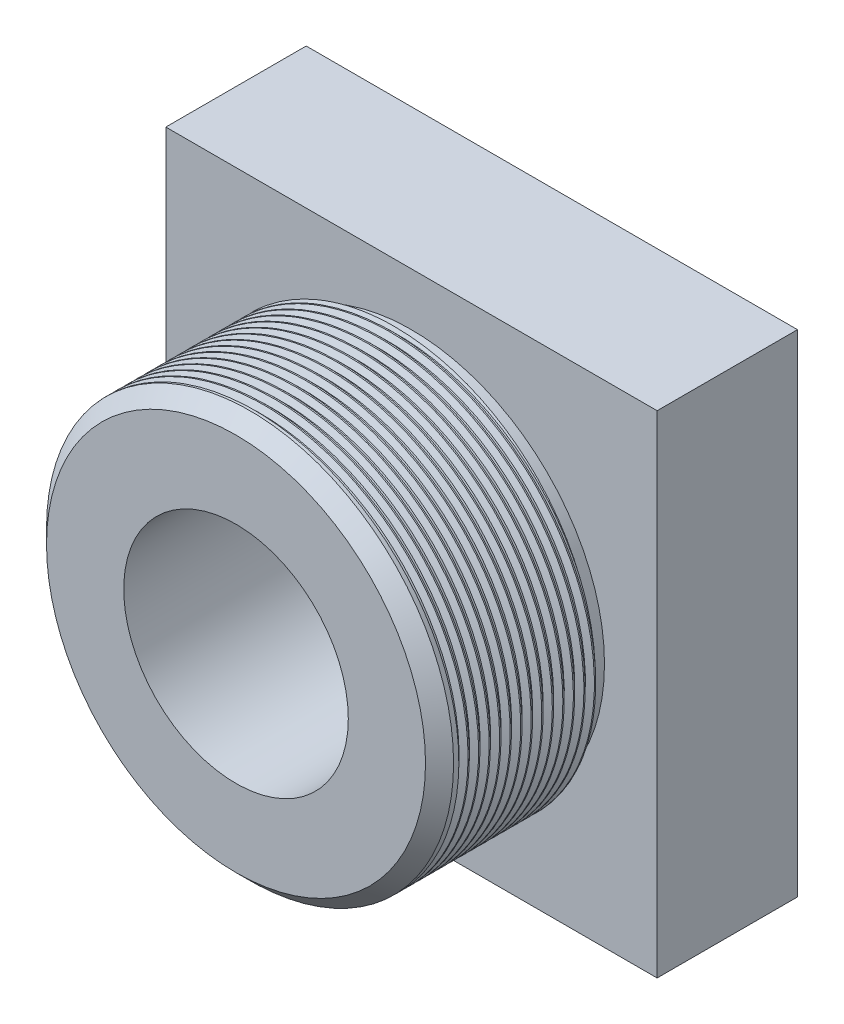
from build123d import *

# Parameters (mm, degrees)
SKETCH1_W           = 70
SKETCH1_H           = 70
SKETCH1_R           = 16
BOSS_EXTRUDE1_DEPTH = 20
SKETCH3_R           = 27.5
SKETCH3_R_2         = 16
BOSS_EXTRUDE2_DEPTH = 2
SKETCH4_R           = 29
SKETCH4_R_2         = 16
BOSS_EXTRUDE3_DEPTH = 23
CHAMFER1_SIZE       = 2
THREAD1_PITCH       = 1.5


with BuildPart() as part:
    # Sketch1 → Boss-Extrude1 (new body)
    with BuildSketch(Plane.XY):
        Rectangle(SKETCH1_W, SKETCH1_H)
        Circle(SKETCH1_R, mode=Mode.SUBTRACT)
    extrude(amount=BOSS_EXTRUDE1_DEPTH)

    # Sketch3 → Boss-Extrude2 (add)
    with BuildSketch(Plane.XY.offset(20)):
        Circle(SKETCH3_R)
        Circle(SKETCH3_R_2, mode=Mode.SUBTRACT)
    extrude(amount=BOSS_EXTRUDE2_DEPTH)

    # Sketch4 → Boss-Extrude3 (add)
    with BuildSketch(Plane.XY.offset(22)):
        Circle(SKETCH4_R)
        Circle(SKETCH4_R_2, mode=Mode.SUBTRACT)
    extrude(amount=BOSS_EXTRUDE3_DEPTH)

    # Chamfer1
    chamfer1_edges = [part.edges().sort_by_distance(p)[0] for p in [
        (-29, 0, 45),
    ]]
    chamfer(chamfer1_edges, length=CHAMFER1_SIZE)

    # Thread1: the profile of Thread Profile1 profile screwed along a right-hand helix of 14 turns, 8 arcs to a turn; built about Z, then put on its axis
    thread1_z = Axis((0, 0, 0), (0, 0, 1))
    thread1_corners = [(29.0003, 0, -0.000173205), (29.0003, 0, 1.312673201), (28.188101187, 0, 0.843749998), (28.188101187, 0, 0.468749998)]
    with BuildLine(mode=Mode.PRIVATE) as thread1_profile:
        Line(thread1_corners[0], thread1_corners[1])
        Line(thread1_corners[1], thread1_corners[2])
        Line(thread1_corners[2], thread1_corners[3])
        Line(thread1_corners[3], thread1_corners[0])
    thread1_cap = Face(thread1_profile.wire())
    thread1_turn_angles = [0, 22.5, 45, 67.5, 90, 112.5, 135, 157.5, 180, 202.5, 225, 247.5, 270, 292.5, 315, 337.5, 360]
    thread1_turn_weights = [1, 0.9238795325112867, 1, 0.9238795325112867, 1, 0.9238795325112867, 1, 0.9238795325112867, 1, 0.9238795325112867, 1, 0.9238795325112867, 1, 0.9238795325112867, 1, 0.9238795325112867, 1]
    thread1_turn_rails = [Edge.make_bspline([Vector(p[0], p[1], 0).rotate(thread1_z, thread1_turn_angles[k]) / thread1_turn_weights[k] + Vector(0, 0, p[2] + THREAD1_PITCH * thread1_turn_angles[k] / 360) for k in range(17)], [0, 0, 0, 1, 1, 2, 2, 3, 3, 4, 4, 5, 5, 6, 6, 7, 7, 8, 8, 8], 2, thread1_turn_weights) for p in thread1_corners]
    thread1_turn_sides = [Face.make_surface_from_curves(thread1_turn_rails[p[0]], thread1_turn_rails[p[1]]) for p in [(0, 1), (1, 2), (2, 3), (3, 0)]]
    thread1 = Plane(origin=(0, 0, 43), x_dir=(-1, 0, 0), z_dir=(0, 0, -1)) * Solid(Shell([*[p.moved(Location((0, 0, THREAD1_PITCH * i))) for i in range(14) for p in thread1_turn_sides], thread1_cap, thread1_cap.rotate(thread1_z, 5040).moved(Location((0, 0, THREAD1_PITCH * 5040 / 360)))]))
    add(thread1, mode=Mode.SUBTRACT)


solid = part.part
